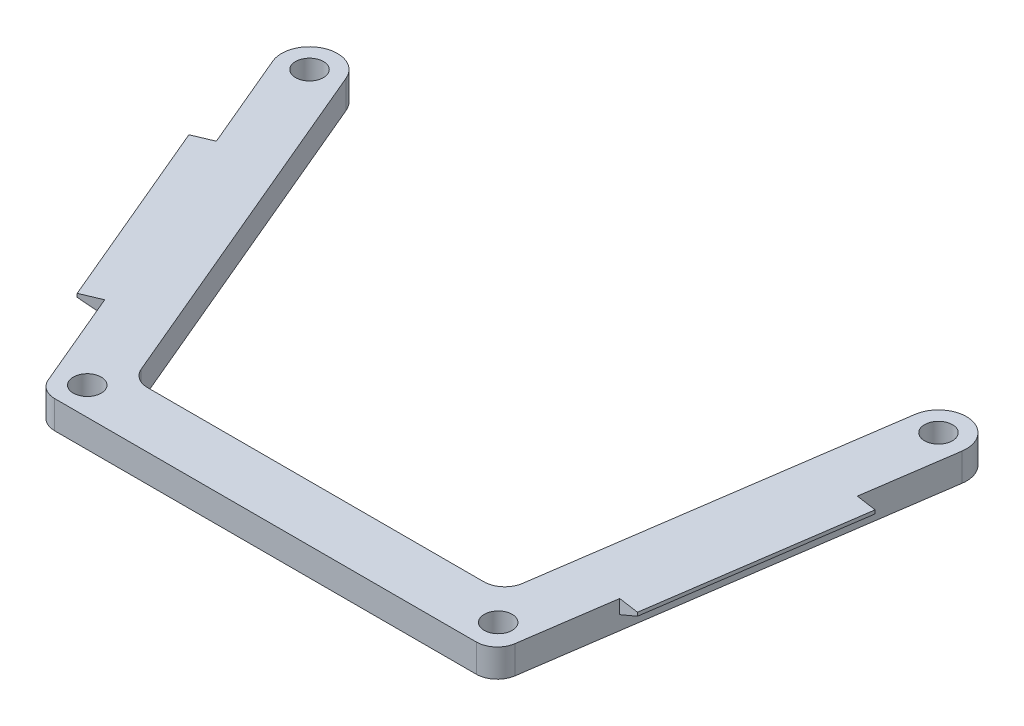
from build123d import *

# Parameters (mm, degrees)
BOSS_EXTRUDE1_DEPTH = 4
SKETCH5_R           = 2.5
CUT_EXTRUDE1_DEPTH  = 3.25
SKETCH6_W           = 30
SKETCH6_H           = 0.5
BOSS_EXTRUDE2_DEPTH = 3
BOSS_EXTRUDE3_DEPTH = 30
SKETCH8_W           = 30
SKETCH8_H           = 0.5
BOSS_EXTRUDE4_DEPTH = 3
BOSS_EXTRUDE5_DEPTH = 30
SKETCH10_R          = 2
CUT_EXTRUDE2_DEPTH  = 4


# Read off the part's stored shape, not the designer's step: M3x0.5 Tapped Hole1
with BuildPart() as part:
    # Sketch1 → Boss-Extrude1 (new body)
    with BuildSketch(Plane(origin=(0, 0, 0), x_dir=(1, 0, 0), z_dir=(0, 1, 0))):
        with BuildLine():
            Line((-26.885531635, 53.445375747), (-3.427655647, -2.16596819))
            ThreePointArc((-3.427655647, -2.16596819), (-2.322135184, -3.499790448), (-0.663506921, -4))
            Line((-0.663506921, -4), (59.665068599, -4))
            ThreePointArc((59.665068599, -4), (61.627788827, -3.268860795), (62.633827917, -1.431819537))
            Line((62.633827917, -1.431819537), (70.758345757, 54.424240617))
            ThreePointArc((70.758345757, 54.424240617), (67.375759383, 58.958345757), (62.841654243, 55.575759383))
            Line((62.841654243, 55.575759383), (55.713279127, 6.568180463))
            ThreePointArc((55.713279127, 6.568180463), (54.707240038, 4.731139205), (52.744519809, 4))
            Line((52.744519809, 4), (4.644548446, 4))
            ThreePointArc((4.644548446, 4), (2.985920183, 4.500209552), (1.88039972, 5.83403181))
            Line((1.88039972, 5.83403181), (-19.514468365, 56.554624253))
            ThreePointArc((-19.514468365, 56.554624253), (-24.754624253, 58.685531635), (-26.885531635, 53.445375747))
        make_face()
    extrude(amount=BOSS_EXTRUDE1_DEPTH)

    # M3x0.5 Tapped Hole1 outline → M3x0.5 Tapped Hole1 (revolve, cut)
    with BuildSketch(Plane(origin=(-23.2, 0, -55), x_dir=(1, 0, 0), z_dir=(0, 0, 1))):
        Polygon((0, 0), (1.25, 0), (1.25, 3.725), (1.525, 4), (0, 4), align=None)
    revolve(axis=Axis((-23.2, 0, -55), (0, 1, 0)), mode=Mode.SUBTRACT)

    # M3x0.5 Tapped Hole1 2 outline → M3x0.5 Tapped Hole1 2 (revolve, cut)
    with BuildSketch(Plane.XY):
        Polygon((0, 0), (1.25, 0), (1.25, 3.725), (1.525, 4), (0, 4), align=None)
    revolve(axis=Axis((0, 0, 0), (0, 1, 0)), mode=Mode.SUBTRACT)

    # M3x0.5 Tapped Hole1 3 outline → M3x0.5 Tapped Hole1 3 (revolve, cut)
    with BuildSketch(Plane(origin=(58.8, 0, 0), x_dir=(1, 0, 0), z_dir=(0, 0, 1))):
        Polygon((0, 0), (1.25, 0), (1.25, 3.725), (1.525, 4), (0, 4), align=None)
    revolve(axis=Axis((58.8, 0, 0), (0, 1, 0)), mode=Mode.SUBTRACT)

    # M3x0.5 Tapped Hole1 4 outline → M3x0.5 Tapped Hole1 4 (revolve, cut)
    with BuildSketch(Plane(origin=(66.8, 0, -55), x_dir=(1, 0, 0), z_dir=(0, 0, 1))):
        Polygon((0, 0), (1.25, 0), (1.25, 3.725), (1.525, 4), (0, 4), align=None)
    revolve(axis=Axis((66.8, 0, -55), (0, 1, 0)), mode=Mode.SUBTRACT)

    # Sketch5 → Cut-Extrude1 (cut)
    with BuildSketch(Plane.XZ):
        with Locations(Location((-17.4, -41.25, 0), (0, 0, 270))):
            Circle(SKETCH5_R)
        with Locations(Location((29.4, 0, 0), (0, 0, 270))):
            Circle(SKETCH5_R)
        with Locations(Location((60.8, -13.75, 0), (0, 0, 270))):
            Circle(SKETCH5_R)
        with Locations(Location((-5.8, -13.75, 0), (0, 0, 270))):
            Circle(SKETCH5_R)
        with Locations(Location((64.8, -41.25, 0), (0, 0, 270))):
            Circle(SKETCH5_R)
        with Locations(Location((-11.6, -27.5, 0), (0, 0, 270))):
            Circle(SKETCH5_R)
        with Locations(Location((14.7, 0, 0), (0, 0, 270))):
            Circle(SKETCH5_R)
        with Locations(Location((44.1, 0, 0), (0, 0, 270))):
            Circle(SKETCH5_R)
        with Locations(Location((62.8, -27.5, 0), (0, 0, 270))):
            Circle(SKETCH5_R)
    extrude(amount=-CUT_EXTRUDE1_DEPTH, mode=Mode.SUBTRACT)

    # Sketch6 → Boss-Extrude2 (add)
    with BuildSketch(Plane(origin=(-3.685531635, 0, 1.554624253), x_dir=(0.38865606330829405, 0, 0.921382908705007), z_dir=(-0.921382908705007, 0, 0.38865606330829405))):
        with Locations((-29.514686863, 3.75)):
            Rectangle(SKETCH6_W, SKETCH6_H)
    extrude(amount=BOSS_EXTRUDE2_DEPTH)

    # Sketch7 → Boss-Extrude3 (add)
    with BuildSketch(Plane(origin=(-5.641221056, 0, -13.373584401), x_dir=(0.9213829087050069, 0, -0.3886560633082941), z_dir=(0.3886560633082942, 0, 0.921382908705007))):
        Polygon((-4, 2), (-4, 3.5), (-7, 3.5), align=None)
    extrude(amount=-BOSS_EXTRUDE3_DEPTH)

    # Sketch8 → Boss-Extrude4 (add)
    with BuildSketch(Plane(origin=(61.540087421, 0, 8.951285443), x_dir=(0.14393984571411056, 0, -0.9895864392845114), z_dir=(0.9895864392845114, 0, 0.14393984571411056))):
        with Locations((35.820515092, 3.75)):
            Rectangle(SKETCH8_W, SKETCH8_H)
    extrude(amount=BOSS_EXTRUDE4_DEPTH)

    # Sketch9 → Boss-Extrude5 (add)
    with BuildSketch(Plane(origin=(2.99690173, 0, -20.603699394), x_dir=(0.9895864392845114, 0, 0.14393984571411056), z_dir=(-0.14393984571411056, 0, 0.9895864392845114))):
        Polygon((65.18768263, 3.5), (62.18768263, 3.5), (62.18768263, 2), align=None)
    extrude(amount=-BOSS_EXTRUDE5_DEPTH)

    # Sketch10 → Cut-Extrude2 (cut)
    with BuildSketch(Plane(origin=(0, 4, 0), x_dir=(1, 0, 0), z_dir=(0, 1, 0))):
        with Locations(Location((-23.2, 55, 0), (0, 0, 270))):
            Circle(SKETCH10_R)
        with Locations(Location((0, 0, 0), (0, 0, 270))):
            Circle(SKETCH10_R)
        with Locations(Location((58.8, 0, 0), (0, 0, 270))):
            Circle(SKETCH10_R)
        with Locations(Location((66.8, 55, 0), (0, 0, 270))):
            Circle(SKETCH10_R)
    extrude(amount=-CUT_EXTRUDE2_DEPTH, mode=Mode.SUBTRACT)


solid = part.part
